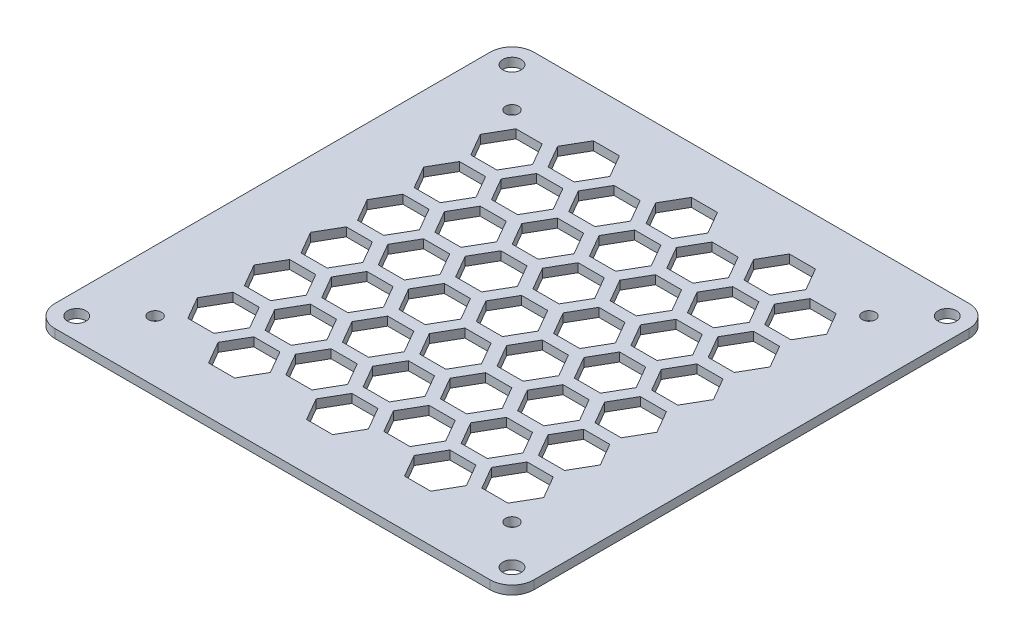
from build123d import *

# Parameters (mm, degrees)
SKETCH_1_W          = 110
SKETCH_1_H          = 110
SKETCH_1_R          = 2.1
EXTRUDE_1_DEPTH     = 2
FILLET_1_R          = 5
SKETCH_4_R          = 1.5
CUT_EXTRUDE_1_DEPTH = 156.576347817
OTHER_1_DEPTH       = 2


# Read off the part's stored shape, not the designer's step: 填充阵列1
with BuildPart() as part:
    # 草图1 → 凸台-拉伸1 (new body)
    with BuildSketch(Plane(origin=(0, 0, 0), x_dir=(1, 0, 0), z_dir=(0, 1, 0))):
        with Locations((55, 55)):
            Rectangle(SKETCH_1_W, SKETCH_1_H)
        with Locations(Location((5, 105, 0), (0, 0, 270))):
            Circle(SKETCH_1_R, mode=Mode.SUBTRACT)
        with Locations(Location((105, 105, 0), (0, 0, 270))):
            Circle(SKETCH_1_R, mode=Mode.SUBTRACT)
        with Locations(Location((105, 5, 0), (0, 0, 270))):
            Circle(SKETCH_1_R, mode=Mode.SUBTRACT)
        with Locations(Location((5, 5, 0), (0, 0, 270))):
            Circle(SKETCH_1_R, mode=Mode.SUBTRACT)
    extrude(amount=EXTRUDE_1_DEPTH)

    # 圆角1
    fillet_1_edges = [part.edges().sort_by_distance(p)[0] for p in [
        (0, 1, -110),
        (110, 1, -110),
        (110, 1, 0),
        (0, 1, 0),
    ]]
    fillet(fillet_1_edges, radius=FILLET_1_R)

    # 草图4 → 切除-拉伸1 (cut, through all)
    with BuildSketch(Plane(origin=(0, 2, 0), x_dir=(1, 0, 0), z_dir=(0, 1, 0))):
        with Locations(Location((14, 96, 0), (0, 0, 270))):
            Circle(SKETCH_4_R)
        with Locations(Location((96, 96, 0), (0, 0, 270))):
            Circle(SKETCH_4_R)
        with Locations(Location((96, 14, 0), (0, 0, 270))):
            Circle(SKETCH_4_R)
        with Locations(Location((14, 14, 0), (0, 0, 270))):
            Circle(SKETCH_4_R)
    extrude(amount=-CUT_EXTRUDE_1_DEPTH, mode=Mode.SUBTRACT)

    # 填充阵列1 outline → 填充阵列1 (cut)
    with BuildSketch(Plane(origin=(0, 0, 0), x_dir=(1, 0, 0), z_dir=(0, 1, 0))):
        Polygon((83.516660498, 16), (80.516660498, 21.196152423), (74.516660498, 21.196152423), (71.516660498, 16), (74.516660498, 10.803847577), (80.516660498, 10.803847577), align=None)
        Polygon((61, 55), (58, 60.196152423), (52, 60.196152423), (49, 55), (52, 49.803847577), (58, 49.803847577), align=None)
        Polygon((72.258330249, 35.5), (69.258330249, 40.696152423), (63.258330249, 40.696152423), (60.258330249, 35.5), (63.258330249, 30.303847577), (69.258330249, 30.303847577), align=None)
        Polygon((38.483339502, 94), (35.483339502, 99.196152423), (29.483339502, 99.196152423), (26.483339502, 94), (29.483339502, 88.803847577), (35.483339502, 88.803847577), align=None)
        Polygon((49.741669751, 74.5), (46.741669751, 79.696152423), (40.741669751, 79.696152423), (37.741669751, 74.5), (40.741669751, 69.303847577), (46.741669751, 69.303847577), align=None)
        Polygon((58, 21.196152423), (52, 21.196152423), (49, 16), (52, 10.803847577), (58, 10.803847577), (61, 16), align=None)
        Polygon((35.483339502, 21.196152423), (29.483339502, 21.196152423), (26.483339502, 16), (29.483339502, 10.803847577), (35.483339502, 10.803847577), (38.483339502, 16), align=None)
        Polygon((85.774990748, 40.696152423), (82.774990748, 35.5), (85.774990748, 30.303847577), (91.774990748, 30.303847577), (94.774990748, 35.5), (91.774990748, 40.696152423), align=None)
        Polygon((83.516660498, 81), (80.516660498, 86.196152423), (74.516660498, 86.196152423), (71.516660498, 81), (74.516660498, 75.803847577), (80.516660498, 75.803847577), align=None)
        Polygon((94.774990748, 61.5), (91.774990748, 66.696152423), (85.774990748, 66.696152423), (82.774990748, 61.5), (85.774990748, 56.303847577), (91.774990748, 56.303847577), align=None)
        Polygon((35.483339502, 86.196152423), (29.483339502, 86.196152423), (26.483339502, 81), (29.483339502, 75.803847577), (35.483339502, 75.803847577), (38.483339502, 81), align=None)
        Polygon((58, 86.196152423), (52, 86.196152423), (49, 81), (52, 75.803847577), (58, 75.803847577), (61, 81), align=None)
        Polygon((63.258330249, 66.696152423), (60.258330249, 61.5), (63.258330249, 56.303847577), (69.258330249, 56.303847577), (72.258330249, 61.5), (69.258330249, 66.696152423), align=None)
        Polygon((40.741669751, 27.696152423), (37.741669751, 22.5), (40.741669751, 17.303847577), (46.741669751, 17.303847577), (49.741669751, 22.5), (46.741669751, 27.696152423), align=None)
        Polygon((52, 47.196152423), (49, 42), (52, 36.803847577), (58, 36.803847577), (61, 42), (58, 47.196152423), align=None)
        Polygon((83.516660498, 68), (80.516660498, 73.196152423), (74.516660498, 73.196152423), (71.516660498, 68), (74.516660498, 62.803847577), (80.516660498, 62.803847577), align=None)
        Polygon((94.774990748, 48.5), (91.774990748, 53.696152423), (85.774990748, 53.696152423), (82.774990748, 48.5), (85.774990748, 43.303847577), (91.774990748, 43.303847577), align=None)
        Polygon((72.258330249, 87.5), (69.258330249, 92.696152423), (63.258330249, 92.696152423), (60.258330249, 87.5), (63.258330249, 82.303847577), (69.258330249, 82.303847577), align=None)
        Polygon((35.483339502, 73.196152423), (29.483339502, 73.196152423), (26.483339502, 68), (29.483339502, 62.803847577), (35.483339502, 62.803847577), (38.483339502, 68), align=None)
        Polygon((58, 73.196152423), (52, 73.196152423), (49, 68), (52, 62.803847577), (58, 62.803847577), (61, 68), align=None)
        Polygon((63.258330249, 53.696152423), (60.258330249, 48.5), (63.258330249, 43.303847577), (69.258330249, 43.303847577), (72.258330249, 48.5), (69.258330249, 53.696152423), align=None)
        Polygon((85.774990748, 92.696152423), (82.774990748, 87.5), (85.774990748, 82.303847577), (91.774990748, 82.303847577), (94.774990748, 87.5), (91.774990748, 92.696152423), align=None)
        Polygon((52, 34.196152423), (49, 29), (52, 23.803847577), (58, 23.803847577), (61, 29), (58, 34.196152423), align=None)
        Polygon((24.225009252, 53.696152423), (18.225009252, 53.696152423), (15.225009252, 48.5), (18.225009252, 43.303847577), (24.225009252, 43.303847577), (27.225009252, 48.5), align=None)
        Polygon((46.741669751, 53.696152423), (40.741669751, 53.696152423), (37.741669751, 48.5), (40.741669751, 43.303847577), (46.741669751, 43.303847577), (49.741669751, 48.5), align=None)
        Polygon((74.516660498, 34.196152423), (71.516660498, 29), (74.516660498, 23.803847577), (80.516660498, 23.803847577), (83.516660498, 29), (80.516660498, 34.196152423), align=None)
        Polygon((83.516660498, 55), (80.516660498, 60.196152423), (74.516660498, 60.196152423), (71.516660498, 55), (74.516660498, 49.803847577), (80.516660498, 49.803847577), align=None)
        Polygon((72.258330249, 74.5), (69.258330249, 79.696152423), (63.258330249, 79.696152423), (60.258330249, 74.5), (63.258330249, 69.303847577), (69.258330249, 69.303847577), align=None)
        Polygon((61, 94), (58, 99.196152423), (52, 99.196152423), (49, 94), (52, 88.803847577), (58, 88.803847577), align=None)
        Polygon((35.483339502, 60.196152423), (29.483339502, 60.196152423), (26.483339502, 55), (29.483339502, 49.803847577), (35.483339502, 49.803847577), (38.483339502, 55), align=None)
        Polygon((85.774990748, 79.696152423), (82.774990748, 74.5), (85.774990748, 69.303847577), (91.774990748, 69.303847577), (94.774990748, 74.5), (91.774990748, 79.696152423), align=None)
        Polygon((24.225009252, 92.696152423), (18.225009252, 92.696152423), (15.225009252, 87.5), (18.225009252, 82.303847577), (24.225009252, 82.303847577), (27.225009252, 87.5), align=None)
        Polygon((46.741669751, 92.696152423), (40.741669751, 92.696152423), (37.741669751, 87.5), (40.741669751, 82.303847577), (46.741669751, 82.303847577), (49.741669751, 87.5), align=None)
        Polygon((29.483339502, 34.196152423), (26.483339502, 29), (29.483339502, 23.803847577), (35.483339502, 23.803847577), (38.483339502, 29), (35.483339502, 34.196152423), align=None)
        Polygon((24.225009252, 79.696152423), (18.225009252, 79.696152423), (15.225009252, 74.5), (18.225009252, 69.303847577), (24.225009252, 69.303847577), (27.225009252, 74.5), align=None)
        Polygon((74.516660498, 99.196152423), (71.516660498, 94), (74.516660498, 88.803847577), (80.516660498, 88.803847577), (83.516660498, 94), (80.516660498, 99.196152423), align=None)
        Polygon((40.741669751, 40.696152423), (37.741669751, 35.5), (40.741669751, 30.303847577), (46.741669751, 30.303847577), (49.741669751, 35.5), (46.741669751, 40.696152423), align=None)
        Polygon((94.774990748, 22.5), (91.774990748, 27.696152423), (85.774990748, 27.696152423), (82.774990748, 22.5), (85.774990748, 17.303847577), (91.774990748, 17.303847577), align=None)
        Polygon((83.516660498, 42), (80.516660498, 47.196152423), (74.516660498, 47.196152423), (71.516660498, 42), (74.516660498, 36.803847577), (80.516660498, 36.803847577), align=None)
        Polygon((24.225009252, 66.696152423), (18.225009252, 66.696152423), (15.225009252, 61.5), (18.225009252, 56.303847577), (24.225009252, 56.303847577), (27.225009252, 61.5), align=None)
        Polygon((46.741669751, 66.696152423), (40.741669751, 66.696152423), (37.741669751, 61.5), (40.741669751, 56.303847577), (46.741669751, 56.303847577), (49.741669751, 61.5), align=None)
        Polygon((63.258330249, 27.696152423), (60.258330249, 22.5), (63.258330249, 17.303847577), (69.258330249, 17.303847577), (72.258330249, 22.5), (69.258330249, 27.696152423), align=None)
        Polygon((18.225009252, 40.696152423), (15.225009252, 35.5), (18.225009252, 30.303847577), (24.225009252, 30.303847577), (27.225009252, 35.5), (24.225009252, 40.696152423), align=None)
        Polygon((38.483339502, 42), (35.483339502, 47.196152423), (29.483339502, 47.196152423), (26.483339502, 42), (29.483339502, 36.803847577), (35.483339502, 36.803847577), align=None)
        Polygon((18.225009252, 27.696152423), (15.225009252, 22.5), (18.225009252, 17.303847577), (24.225009252, 17.303847577), (27.225009252, 22.5), (24.225009252, 27.696152423), align=None)
    extrude(amount=OTHER_1_DEPTH, mode=Mode.SUBTRACT)


solid = part.part
